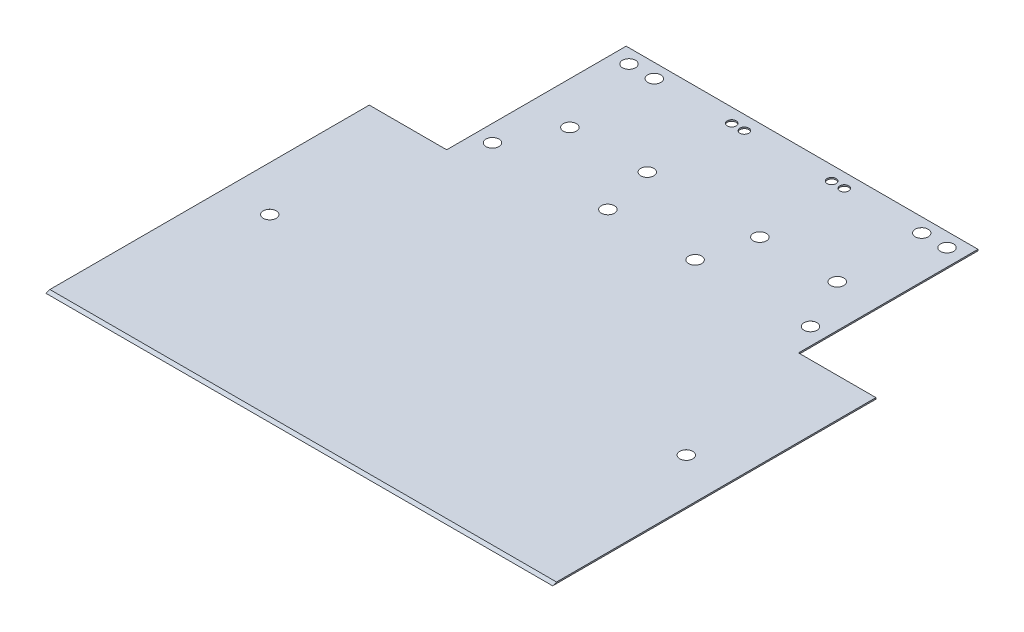
from build123d import *

# Parameters (mm, degrees)
SALIENTE_EXTRUIR1_DEPTH          = 0.5
CORTAR_EXTRUIR4_REACH            = 128.793
CROQUIS6_R                       = 1.585
CORTAR_EXTRUIR5_REACH            = 128.793
CROQUIS7_R                       = 1.585
CORTAR_EXTRUIR6_REACH            = 128.793
CROQUIS8_R                       = 1.585
CORTAR_EXTRUIR7_REACH            = 128.793
CROQUIS9_R                       = 1.585
CORTAR_EXTRUIR8_REACH            = 128.793
CROQUIS5_R                       = 1.585
CORTAR_EXTRUIR9_REACH            = 202.939
CROQUIS11_R                      = 3.03
CORTAR_EXTRUIR10_DEPTH           = 1
CORTAR_EXTRUIR10_DRAFT           = -55
CORTAR_EXTRUIR10_PROFILE_2_DEPTH = 1
CORTAR_EXTRUIR10_PROFILE_2_DRAFT = -55
CORTAR_EXTRUIR10_PROFILE_3_DEPTH = 1
CORTAR_EXTRUIR10_PROFILE_3_DRAFT = -55
CORTAR_EXTRUIR10_PROFILE_4_DEPTH = 1
CORTAR_EXTRUIR10_PROFILE_4_DRAFT = -55
CORTAR_EXTRUIR10_PROFILE_5_DEPTH = 1
CORTAR_EXTRUIR10_PROFILE_5_DRAFT = -55
CORTAR_EXTRUIR10_PROFILE_6_DEPTH = 1
CORTAR_EXTRUIR10_PROFILE_6_DRAFT = -55
CORTAR_EXTRUIR10_PROFILE_7_DEPTH = 1
CORTAR_EXTRUIR10_PROFILE_7_DRAFT = -55
SIMETR_A7_COPY_1_SKETCH_R        = 3.03
SIMETR_A7_COPY_1_DEPTH           = 1
SIMETR_A7_COPY_1_DRAFT           = -55
SIMETR_A7_COPY_2_SKETCH_R        = 3.03
SIMETR_A7_COPY_2_DEPTH           = 1
SIMETR_A7_COPY_2_DRAFT           = -55
SIMETR_A7_COPY_3_SKETCH_R        = 3.03
SIMETR_A7_COPY_3_DEPTH           = 1
SIMETR_A7_COPY_3_DRAFT           = -55
SIMETR_A7_COPY_4_SKETCH_R        = 3.03
SIMETR_A7_COPY_4_DEPTH           = 1
SIMETR_A7_COPY_4_DRAFT           = -55
SIMETR_A7_COPY_5_SKETCH_R        = 3.03
SIMETR_A7_COPY_5_DEPTH           = 1
SIMETR_A7_COPY_5_DRAFT           = -55
SIMETR_A7_COPY_6_SKETCH_R        = 3.03
SIMETR_A7_COPY_6_DEPTH           = 1
SIMETR_A7_COPY_6_DRAFT           = -55
SIMETR_A7_COPY_7_SKETCH_R        = 3.03
SIMETR_A7_COPY_7_DEPTH           = 1
SIMETR_A7_COPY_7_DRAFT           = -55
SIMETR_A7_COPY_8_SKETCH_R        = 3.03
SIMETR_A7_COPY_8_DEPTH           = 1
SIMETR_A7_COPY_8_DRAFT           = -55
SIMETR_A7_COPY_9_SKETCH_R        = 3.03
SIMETR_A7_COPY_9_DEPTH           = 1
SIMETR_A7_COPY_9_DRAFT           = -55
SIMETR_A7_COPY_10_SKETCH_R       = 3.03
SIMETR_A7_COPY_10_DEPTH          = 1
SIMETR_A7_COPY_10_DRAFT          = -55
SIMETR_A7_COPY_11_SKETCH_R       = 3.03
SIMETR_A7_COPY_11_DEPTH          = 1
SIMETR_A7_COPY_11_DRAFT          = -55
SIMETR_A7_COPY_12_SKETCH_R       = 3.03
SIMETR_A7_COPY_12_DEPTH          = 1
SIMETR_A7_COPY_12_DRAFT          = -55
SIMETR_A7_COPY_13_SKETCH_R       = 3.03
SIMETR_A7_COPY_13_DEPTH          = 1
SIMETR_A7_COPY_13_DRAFT          = -55


with BuildPart() as part:
    # Croquis2 → Saliente-Extruir1 (new body)
    with BuildSketch(Plane(origin=(0, 0, 0), x_dir=(1, 0, 0), z_dir=(0, 1, 0))):
        Polygon((-90, 25.54), (-62.5, 25.54), (-62.5, 89.31), (62.5, 89.31), (62.5, 25.54), (90, 25.54), (90, -89.31), (-90, -89.31), align=None)
    saliente_extruir1 = extrude(amount=SALIENTE_EXTRUIR1_DEPTH)

    # Croquis6 → Cortar-Extruir4 (cut, up to next)
    with BuildSketch(Plane(origin=(0, 0.5, 0), x_dir=(1, 0, 0), z_dir=(0, 1, 0)), mode=Mode.PRIVATE) as cortar_extruir4_sk1:
        with Locations((-56.5, 35.81)):
            Circle(CROQUIS6_R)
    cortar_extruir4_tool1 = extrude(cortar_extruir4_sk1.sketch, amount=-CORTAR_EXTRUIR4_REACH, mode=Mode.PRIVATE) & part.part
    # Croquis6 → Cortar-Extruir4 (cut, up to next)
    with BuildSketch(Plane(origin=(0, 0.5, 0), x_dir=(1, 0, 0), z_dir=(0, 1, 0)), mode=Mode.PRIVATE) as cortar_extruir4_sk2:
        with Locations((-15.5, 35.81)):
            Circle(CROQUIS6_R)
    cortar_extruir4_tool2 = extrude(cortar_extruir4_sk2.sketch, amount=-CORTAR_EXTRUIR4_REACH, mode=Mode.PRIVATE) & part.part
    # Croquis6 → Cortar-Extruir4 (cut, up to next)
    with BuildSketch(Plane(origin=(0, 0.5, 0), x_dir=(1, 0, 0), z_dir=(0, 1, 0)), mode=Mode.PRIVATE) as cortar_extruir4_sk3:
        with Locations((-15.5, 84.31)):
            Circle(CROQUIS6_R)
    cortar_extruir4_tool3 = extrude(cortar_extruir4_sk3.sketch, amount=-CORTAR_EXTRUIR4_REACH, mode=Mode.PRIVATE) & part.part
    # Croquis6 → Cortar-Extruir4 (cut, up to next)
    with BuildSketch(Plane(origin=(0, 0.5, 0), x_dir=(1, 0, 0), z_dir=(0, 1, 0)), mode=Mode.PRIVATE) as cortar_extruir4_sk4:
        with Locations((-56.5, 84.31)):
            Circle(CROQUIS6_R)
    cortar_extruir4_tool4 = extrude(cortar_extruir4_sk4.sketch, amount=-CORTAR_EXTRUIR4_REACH, mode=Mode.PRIVATE) & part.part
    add(cortar_extruir4_tool1.solids().sort_by_distance((-56.5, 0.5, -35.81))[0], mode=Mode.SUBTRACT)
    add(cortar_extruir4_tool2.solids().sort_by_distance((-15.5, 0.5, -35.81))[0], mode=Mode.SUBTRACT)
    add(cortar_extruir4_tool3.solids().sort_by_distance((-15.5, 0.5, -84.31))[0], mode=Mode.SUBTRACT)
    add(cortar_extruir4_tool4.solids().sort_by_distance((-56.5, 0.5, -84.31))[0], mode=Mode.SUBTRACT)

    # Croquis7 → Cortar-Extruir5 (cut, up to next)
    with BuildSketch(Plane(origin=(0, 0.5, 0), x_dir=(1, 0, 0), z_dir=(0, 1, 0)), mode=Mode.PRIVATE) as cortar_extruir5_sk1:
        with Locations((56.5, 35.81)):
            Circle(CROQUIS7_R)
    cortar_extruir5_tool1 = extrude(cortar_extruir5_sk1.sketch, amount=-CORTAR_EXTRUIR5_REACH, mode=Mode.PRIVATE) & part.part
    # Croquis7 → Cortar-Extruir5 (cut, up to next)
    with BuildSketch(Plane(origin=(0, 0.5, 0), x_dir=(1, 0, 0), z_dir=(0, 1, 0)), mode=Mode.PRIVATE) as cortar_extruir5_sk2:
        with Locations((15.5, 35.81)):
            Circle(CROQUIS7_R)
    cortar_extruir5_tool2 = extrude(cortar_extruir5_sk2.sketch, amount=-CORTAR_EXTRUIR5_REACH, mode=Mode.PRIVATE) & part.part
    # Croquis7 → Cortar-Extruir5 (cut, up to next)
    with BuildSketch(Plane(origin=(0, 0.5, 0), x_dir=(1, 0, 0), z_dir=(0, 1, 0)), mode=Mode.PRIVATE) as cortar_extruir5_sk3:
        with Locations((15.5, 84.31)):
            Circle(CROQUIS7_R)
    cortar_extruir5_tool3 = extrude(cortar_extruir5_sk3.sketch, amount=-CORTAR_EXTRUIR5_REACH, mode=Mode.PRIVATE) & part.part
    # Croquis7 → Cortar-Extruir5 (cut, up to next)
    with BuildSketch(Plane(origin=(0, 0.5, 0), x_dir=(1, 0, 0), z_dir=(0, 1, 0)), mode=Mode.PRIVATE) as cortar_extruir5_sk4:
        with Locations((56.5, 84.31)):
            Circle(CROQUIS7_R)
    cortar_extruir5_tool4 = extrude(cortar_extruir5_sk4.sketch, amount=-CORTAR_EXTRUIR5_REACH, mode=Mode.PRIVATE) & part.part
    add(cortar_extruir5_tool1.solids().sort_by_distance((56.5, 0.5, -35.81))[0], mode=Mode.SUBTRACT)
    add(cortar_extruir5_tool2.solids().sort_by_distance((15.5, 0.5, -35.81))[0], mode=Mode.SUBTRACT)
    add(cortar_extruir5_tool3.solids().sort_by_distance((15.5, 0.5, -84.31))[0], mode=Mode.SUBTRACT)
    add(cortar_extruir5_tool4.solids().sort_by_distance((56.5, 0.5, -84.31))[0], mode=Mode.SUBTRACT)

    # Simetría3: Saliente-Extruir1 across plane
    add(saliente_extruir1.mirror(Plane(origin=(0, 0, 0), x_dir=(0, 0, 1), z_dir=(1, 0, 0))))

    # Croquis8 → Cortar-Extruir6 (cut, up to next)
    with BuildSketch(Plane(origin=(0, 0.5, 0), x_dir=(1, 0, 0), z_dir=(0, 1, 0)), mode=Mode.PRIVATE) as cortar_extruir6_sk1:
        with Locations((-20, 54.31)):
            Circle(CROQUIS8_R)
    cortar_extruir6_tool1 = extrude(cortar_extruir6_sk1.sketch, amount=-CORTAR_EXTRUIR6_REACH, mode=Mode.PRIVATE) & part.part
    # Croquis8 → Cortar-Extruir6 (cut, up to next)
    with BuildSketch(Plane(origin=(0, 0.5, 0), x_dir=(1, 0, 0), z_dir=(0, 1, 0)), mode=Mode.PRIVATE) as cortar_extruir6_sk2:
        with Locations((-47.5, 54.31)):
            Circle(CROQUIS8_R)
    cortar_extruir6_tool2 = extrude(cortar_extruir6_sk2.sketch, amount=-CORTAR_EXTRUIR6_REACH, mode=Mode.PRIVATE) & part.part
    # Croquis8 → Cortar-Extruir6 (cut, up to next)
    with BuildSketch(Plane(origin=(0, 0.5, 0), x_dir=(1, 0, 0), z_dir=(0, 1, 0)), mode=Mode.PRIVATE) as cortar_extruir6_sk3:
        with Locations((-47.5, 84.31)):
            Circle(CROQUIS8_R)
    cortar_extruir6_tool3 = extrude(cortar_extruir6_sk3.sketch, amount=-CORTAR_EXTRUIR6_REACH, mode=Mode.PRIVATE) & part.part
    # Croquis8 → Cortar-Extruir6 (cut, up to next)
    with BuildSketch(Plane(origin=(0, 0.5, 0), x_dir=(1, 0, 0), z_dir=(0, 1, 0)), mode=Mode.PRIVATE) as cortar_extruir6_sk4:
        with Locations((-20, 84.31)):
            Circle(CROQUIS8_R)
    cortar_extruir6_tool4 = extrude(cortar_extruir6_sk4.sketch, amount=-CORTAR_EXTRUIR6_REACH, mode=Mode.PRIVATE) & part.part
    cortar_extruir6_1 = cortar_extruir6_tool1.solids().sort_by_distance((-20, 0.5, -54.31))[0]
    add(cortar_extruir6_1, mode=Mode.SUBTRACT)
    cortar_extruir6_2 = cortar_extruir6_tool2.solids().sort_by_distance((-47.5, 0.5, -54.31))[0]
    add(cortar_extruir6_2, mode=Mode.SUBTRACT)
    cortar_extruir6_3 = cortar_extruir6_tool3.solids().sort_by_distance((-47.5, 0.5, -84.31))[0]
    add(cortar_extruir6_3, mode=Mode.SUBTRACT)
    cortar_extruir6_4 = cortar_extruir6_tool4.solids().sort_by_distance((-20, 0.5, -84.31))[0]
    add(cortar_extruir6_4, mode=Mode.SUBTRACT)
    cortar_extruir6 = cortar_extruir6_1 + cortar_extruir6_2 + cortar_extruir6_3 + cortar_extruir6_4  # Cortar-Extruir6 as one shape, for the pattern or mirror that repeats it

    # Simetría4: Cortar-Extruir6 across plane
    add(cortar_extruir6.mirror(Plane(origin=(0, 0, 0), x_dir=(0, 0, 1), z_dir=(1, 0, 0))), mode=Mode.SUBTRACT)

    # Croquis9 → Cortar-Extruir7 (cut, up to next)
    with BuildSketch(Plane.XZ, mode=Mode.PRIVATE) as cortar_extruir7_sk1:
        with Locations((56.5, -35.81)):
            Circle(CROQUIS9_R)
    cortar_extruir7_tool1 = extrude(cortar_extruir7_sk1.sketch, amount=-CORTAR_EXTRUIR7_REACH, mode=Mode.PRIVATE) & part.part
    # Croquis9 → Cortar-Extruir7 (cut, up to next)
    with BuildSketch(Plane.XZ, mode=Mode.PRIVATE) as cortar_extruir7_sk2:
        with Locations((15.5, -35.81)):
            Circle(CROQUIS9_R)
    cortar_extruir7_tool2 = extrude(cortar_extruir7_sk2.sketch, amount=-CORTAR_EXTRUIR7_REACH, mode=Mode.PRIVATE) & part.part
    # Croquis9 → Cortar-Extruir7 (cut, up to next)
    with BuildSketch(Plane.XZ, mode=Mode.PRIVATE) as cortar_extruir7_sk3:
        with Locations((15.5, -84.31)):
            Circle(CROQUIS9_R)
    cortar_extruir7_tool3 = extrude(cortar_extruir7_sk3.sketch, amount=-CORTAR_EXTRUIR7_REACH, mode=Mode.PRIVATE) & part.part
    # Croquis9 → Cortar-Extruir7 (cut, up to next)
    with BuildSketch(Plane.XZ, mode=Mode.PRIVATE) as cortar_extruir7_sk4:
        with Locations((56.5, -84.31)):
            Circle(CROQUIS9_R)
    cortar_extruir7_tool4 = extrude(cortar_extruir7_sk4.sketch, amount=-CORTAR_EXTRUIR7_REACH, mode=Mode.PRIVATE) & part.part
    cortar_extruir7_1 = cortar_extruir7_tool1.solids().sort_by_distance((56.5, 0, -35.81))[0]
    add(cortar_extruir7_1, mode=Mode.SUBTRACT)
    cortar_extruir7_2 = cortar_extruir7_tool2.solids().sort_by_distance((15.5, 0, -35.81))[0]
    add(cortar_extruir7_2, mode=Mode.SUBTRACT)
    cortar_extruir7_3 = cortar_extruir7_tool3.solids().sort_by_distance((15.5, 0, -84.31))[0]
    add(cortar_extruir7_3, mode=Mode.SUBTRACT)
    cortar_extruir7_4 = cortar_extruir7_tool4.solids().sort_by_distance((56.5, 0, -84.31))[0]
    add(cortar_extruir7_4, mode=Mode.SUBTRACT)
    cortar_extruir7 = cortar_extruir7_1 + cortar_extruir7_2 + cortar_extruir7_3 + cortar_extruir7_4  # Cortar-Extruir7 as one shape, for the pattern or mirror that repeats it

    # Simetría5: Cortar-Extruir7 across plane
    add(cortar_extruir7.mirror(Plane(origin=(0, 0, 0), x_dir=(0, 0, 1), z_dir=(1, 0, 0))), mode=Mode.SUBTRACT)

    # Croquis5 → Cortar-Extruir8 (cut, up to next)
    with BuildSketch(Plane(origin=(0, 0.5, 0), x_dir=(1, 0, 0), z_dir=(0, 1, 0)), mode=Mode.PRIVATE) as cortar_extruir8_sk1:
        with Locations((74, -25.820403824)):
            Circle(CROQUIS5_R)
    cortar_extruir8_tool1 = extrude(cortar_extruir8_sk1.sketch, amount=-CORTAR_EXTRUIR8_REACH, mode=Mode.PRIVATE) & part.part
    cortar_extruir8 = cortar_extruir8_tool1.solids().sort_by_distance((74, 0.5, 25.820404))[0]
    add(cortar_extruir8, mode=Mode.SUBTRACT)

    # Simetría6: Cortar-Extruir8 across plane
    add(cortar_extruir8.mirror(Plane(origin=(0, 0, 0), x_dir=(0, 0, 1), z_dir=(1, 0, 0))), mode=Mode.SUBTRACT)

    # Croquis3 → Cortar-Extruir9 (cut, up to next)
    with BuildSketch(Plane(origin=(90, 0, 0), x_dir=(0, 0, -1), z_dir=(1, 0, 0)), mode=Mode.PRIVATE) as cortar_extruir9_sk1:
        Polygon((-89.31, 0), (-87.93626129, 0.5), (-89.31, 0.5), align=None)
    cortar_extruir9_tool1 = extrude(cortar_extruir9_sk1.sketch, amount=-CORTAR_EXTRUIR9_REACH, mode=Mode.PRIVATE) & part.part
    add(cortar_extruir9_tool1.solids().sort_by_distance((90, 0.333333, 88.852087))[0], mode=Mode.SUBTRACT)


with BuildPart() as cortar_extruir10_tool:
    # Croquis11 → Cortar-Extruir10 (with draft: the straight prism first)
    with BuildSketch(Plane.XZ):
        with Locations((-74, 25.820403824)):
            Circle(CROQUIS11_R)
    extrude(amount=-CORTAR_EXTRUIR10_DEPTH)
    # Cortar-Extruir10: the draft: its side faces are tilted about the plane it starts from
    cortar_extruir10_sides = [cortar_extruir10_tool.faces().sort_by_distance(p)[0] for p in [
        (-77.03, 0.5, 25.820403824),
    ]]
    draft(cortar_extruir10_sides, Plane.XZ, CORTAR_EXTRUIR10_DRAFT)


with BuildPart() as part_1:
    add(part.part)

    # Cortar-Extruir10: cut by cortar_extruir10_tool
    add(cortar_extruir10_tool.part, mode=Mode.SUBTRACT)


with BuildPart() as cortar_extruir10_profile_2_tool:
    # Croquis11 → Cortar-Extruir10 profile 2 (with draft: the straight prism first)
    with BuildSketch(Plane.XZ):
        with Locations((-56.5, -35.81)):
            Circle(CROQUIS11_R)
    extrude(amount=-CORTAR_EXTRUIR10_PROFILE_2_DEPTH)
    # Cortar-Extruir10 profile 2: the draft: its side faces are tilted about the plane it starts from
    cortar_extruir10_profile_2_sides = [cortar_extruir10_profile_2_tool.faces().sort_by_distance(p)[0] for p in [
        (-59.53, 0.5, -35.81),
    ]]
    draft(cortar_extruir10_profile_2_sides, Plane.XZ, CORTAR_EXTRUIR10_PROFILE_2_DRAFT)


with BuildPart() as part_2:
    add(part_1.part)

    # Cortar-Extruir10 profile 2: cut by cortar_extruir10_profile_2_tool
    add(cortar_extruir10_profile_2_tool.part, mode=Mode.SUBTRACT)


with BuildPart() as cortar_extruir10_profile_3_tool:
    # Croquis11 → Cortar-Extruir10 profile 3 (with draft: the straight prism first)
    with BuildSketch(Plane.XZ):
        with Locations((-15.5, -35.81)):
            Circle(CROQUIS11_R)
    extrude(amount=-CORTAR_EXTRUIR10_PROFILE_3_DEPTH)
    # Cortar-Extruir10 profile 3: the draft: its side faces are tilted about the plane it starts from
    cortar_extruir10_profile_3_sides = [cortar_extruir10_profile_3_tool.faces().sort_by_distance(p)[0] for p in [
        (-18.53, 0.5, -35.81),
    ]]
    draft(cortar_extruir10_profile_3_sides, Plane.XZ, CORTAR_EXTRUIR10_PROFILE_3_DRAFT)


with BuildPart() as part_3:
    add(part_2.part)

    # Cortar-Extruir10 profile 3: cut by cortar_extruir10_profile_3_tool
    add(cortar_extruir10_profile_3_tool.part, mode=Mode.SUBTRACT)


with BuildPart() as cortar_extruir10_profile_4_tool:
    # Croquis11 → Cortar-Extruir10 profile 4 (with draft: the straight prism first)
    with BuildSketch(Plane.XZ):
        with Locations((-20, -54.31)):
            Circle(CROQUIS11_R)
    extrude(amount=-CORTAR_EXTRUIR10_PROFILE_4_DEPTH)
    # Cortar-Extruir10 profile 4: the draft: its side faces are tilted about the plane it starts from
    cortar_extruir10_profile_4_sides = [cortar_extruir10_profile_4_tool.faces().sort_by_distance(p)[0] for p in [
        (-23.03, 0.5, -54.31),
    ]]
    draft(cortar_extruir10_profile_4_sides, Plane.XZ, CORTAR_EXTRUIR10_PROFILE_4_DRAFT)


with BuildPart() as part_4:
    add(part_3.part)

    # Cortar-Extruir10 profile 4: cut by cortar_extruir10_profile_4_tool
    add(cortar_extruir10_profile_4_tool.part, mode=Mode.SUBTRACT)


with BuildPart() as cortar_extruir10_profile_5_tool:
    # Croquis11 → Cortar-Extruir10 profile 5 (with draft: the straight prism first)
    with BuildSketch(Plane.XZ):
        with Locations((-47.5, -54.31)):
            Circle(CROQUIS11_R)
    extrude(amount=-CORTAR_EXTRUIR10_PROFILE_5_DEPTH)
    # Cortar-Extruir10 profile 5: the draft: its side faces are tilted about the plane it starts from
    cortar_extruir10_profile_5_sides = [cortar_extruir10_profile_5_tool.faces().sort_by_distance(p)[0] for p in [
        (-50.53, 0.5, -54.31),
    ]]
    draft(cortar_extruir10_profile_5_sides, Plane.XZ, CORTAR_EXTRUIR10_PROFILE_5_DRAFT)


with BuildPart() as part_5:
    add(part_4.part)

    # Cortar-Extruir10 profile 5: cut by cortar_extruir10_profile_5_tool
    add(cortar_extruir10_profile_5_tool.part, mode=Mode.SUBTRACT)


with BuildPart() as cortar_extruir10_profile_6_tool:
    # Croquis11 → Cortar-Extruir10 profile 6 (with draft: the straight prism first)
    with BuildSketch(Plane.XZ):
        with Locations((-47.5, -84.31)):
            Circle(CROQUIS11_R)
    extrude(amount=-CORTAR_EXTRUIR10_PROFILE_6_DEPTH)
    # Cortar-Extruir10 profile 6: the draft: its side faces are tilted about the plane it starts from
    cortar_extruir10_profile_6_sides = [cortar_extruir10_profile_6_tool.faces().sort_by_distance(p)[0] for p in [
        (-50.53, 0.5, -84.31),
    ]]
    draft(cortar_extruir10_profile_6_sides, Plane.XZ, CORTAR_EXTRUIR10_PROFILE_6_DRAFT)


with BuildPart() as part_6:
    add(part_5.part)

    # Cortar-Extruir10 profile 6: cut by cortar_extruir10_profile_6_tool
    add(cortar_extruir10_profile_6_tool.part, mode=Mode.SUBTRACT)


with BuildPart() as cortar_extruir10_profile_7_tool:
    # Croquis11 → Cortar-Extruir10 profile 7 (with draft: the straight prism first)
    with BuildSketch(Plane.XZ):
        with Locations((-56.5, -84.31)):
            Circle(CROQUIS11_R)
    extrude(amount=-CORTAR_EXTRUIR10_PROFILE_7_DEPTH)
    # Cortar-Extruir10 profile 7: the draft: its side faces are tilted about the plane it starts from
    cortar_extruir10_profile_7_sides = [cortar_extruir10_profile_7_tool.faces().sort_by_distance(p)[0] for p in [
        (-59.53, 0.5, -84.31),
    ]]
    draft(cortar_extruir10_profile_7_sides, Plane.XZ, CORTAR_EXTRUIR10_PROFILE_7_DRAFT)


with BuildPart() as part_7:
    add(part_6.part)

    # Cortar-Extruir10 profile 7: cut by cortar_extruir10_profile_7_tool
    add(cortar_extruir10_profile_7_tool.part, mode=Mode.SUBTRACT)


with BuildPart() as simetr_a7_copy_1_tool:
    # Simetría7 copy 1 sketch → Simetría7 copy 1 (with draft: the straight prism first)
    with BuildSketch(Plane(origin=(0, 0, 0), x_dir=(-1, 0, 0), z_dir=(0, -1, 0))):
        with Locations((-74, -25.820403824)):
            Circle(SIMETR_A7_COPY_1_SKETCH_R)
    extrude(amount=-SIMETR_A7_COPY_1_DEPTH)
    # Simetría7 copy 1: the draft: its side faces are tilted about the plane it starts from
    simetr_a7_copy_1_sides = [simetr_a7_copy_1_tool.faces().sort_by_distance(p)[0] for p in [
        (77.03, 0.5, 25.820403824),
    ]]
    draft(simetr_a7_copy_1_sides, Plane(origin=(0, 0, 0), x_dir=(-1, 0, 0), z_dir=(0, -1, 0)), SIMETR_A7_COPY_1_DRAFT)


with BuildPart() as part_8:
    add(part_7.part)

    # Simetría7 copy 1: cut by simetr_a7_copy_1_tool
    add(simetr_a7_copy_1_tool.part, mode=Mode.SUBTRACT)


with BuildPart() as simetr_a7_copy_2_tool:
    # Simetría7 copy 2 sketch → Simetría7 copy 2 (with draft: the straight prism first)
    with BuildSketch(Plane(origin=(0, 0, 0), x_dir=(-1, 0, 0), z_dir=(0, -1, 0))):
        with Locations((-56.5, 35.81)):
            Circle(SIMETR_A7_COPY_2_SKETCH_R)
    extrude(amount=-SIMETR_A7_COPY_2_DEPTH)
    # Simetría7 copy 2: the draft: its side faces are tilted about the plane it starts from
    simetr_a7_copy_2_sides = [simetr_a7_copy_2_tool.faces().sort_by_distance(p)[0] for p in [
        (59.53, 0.5, -35.81),
    ]]
    draft(simetr_a7_copy_2_sides, Plane(origin=(0, 0, 0), x_dir=(-1, 0, 0), z_dir=(0, -1, 0)), SIMETR_A7_COPY_2_DRAFT)


with BuildPart() as part_9:
    add(part_8.part)

    # Simetría7 copy 2: cut by simetr_a7_copy_2_tool
    add(simetr_a7_copy_2_tool.part, mode=Mode.SUBTRACT)


with BuildPart() as simetr_a7_copy_3_tool:
    # Simetría7 copy 3 sketch → Simetría7 copy 3 (with draft: the straight prism first)
    with BuildSketch(Plane(origin=(0, 0, 0), x_dir=(-1, 0, 0), z_dir=(0, -1, 0))):
        with Locations((-15.5, 35.81)):
            Circle(SIMETR_A7_COPY_3_SKETCH_R)
    extrude(amount=-SIMETR_A7_COPY_3_DEPTH)
    # Simetría7 copy 3: the draft: its side faces are tilted about the plane it starts from
    simetr_a7_copy_3_sides = [simetr_a7_copy_3_tool.faces().sort_by_distance(p)[0] for p in [
        (18.53, 0.5, -35.81),
    ]]
    draft(simetr_a7_copy_3_sides, Plane(origin=(0, 0, 0), x_dir=(-1, 0, 0), z_dir=(0, -1, 0)), SIMETR_A7_COPY_3_DRAFT)


with BuildPart() as part_10:
    add(part_9.part)

    # Simetría7 copy 3: cut by simetr_a7_copy_3_tool
    add(simetr_a7_copy_3_tool.part, mode=Mode.SUBTRACT)


with BuildPart() as simetr_a7_copy_4_tool:
    # Simetría7 copy 4 sketch → Simetría7 copy 4 (with draft: the straight prism first)
    with BuildSketch(Plane(origin=(0, 0, 0), x_dir=(-1, 0, 0), z_dir=(0, -1, 0))):
        with Locations((-20, 54.31)):
            Circle(SIMETR_A7_COPY_4_SKETCH_R)
    extrude(amount=-SIMETR_A7_COPY_4_DEPTH)
    # Simetría7 copy 4: the draft: its side faces are tilted about the plane it starts from
    simetr_a7_copy_4_sides = [simetr_a7_copy_4_tool.faces().sort_by_distance(p)[0] for p in [
        (23.03, 0.5, -54.31),
    ]]
    draft(simetr_a7_copy_4_sides, Plane(origin=(0, 0, 0), x_dir=(-1, 0, 0), z_dir=(0, -1, 0)), SIMETR_A7_COPY_4_DRAFT)


with BuildPart() as part_11:
    add(part_10.part)

    # Simetría7 copy 4: cut by simetr_a7_copy_4_tool
    add(simetr_a7_copy_4_tool.part, mode=Mode.SUBTRACT)


with BuildPart() as simetr_a7_copy_5_tool:
    # Simetría7 copy 5 sketch → Simetría7 copy 5 (with draft: the straight prism first)
    with BuildSketch(Plane(origin=(0, 0, 0), x_dir=(-1, 0, 0), z_dir=(0, -1, 0))):
        with Locations((-47.5, 54.31)):
            Circle(SIMETR_A7_COPY_5_SKETCH_R)
    extrude(amount=-SIMETR_A7_COPY_5_DEPTH)
    # Simetría7 copy 5: the draft: its side faces are tilted about the plane it starts from
    simetr_a7_copy_5_sides = [simetr_a7_copy_5_tool.faces().sort_by_distance(p)[0] for p in [
        (50.53, 0.5, -54.31),
    ]]
    draft(simetr_a7_copy_5_sides, Plane(origin=(0, 0, 0), x_dir=(-1, 0, 0), z_dir=(0, -1, 0)), SIMETR_A7_COPY_5_DRAFT)


with BuildPart() as part_12:
    add(part_11.part)

    # Simetría7 copy 5: cut by simetr_a7_copy_5_tool
    add(simetr_a7_copy_5_tool.part, mode=Mode.SUBTRACT)


with BuildPart() as simetr_a7_copy_6_tool:
    # Simetría7 copy 6 sketch → Simetría7 copy 6 (with draft: the straight prism first)
    with BuildSketch(Plane(origin=(0, 0, 0), x_dir=(-1, 0, 0), z_dir=(0, -1, 0))):
        with Locations((-47.5, 84.31)):
            Circle(SIMETR_A7_COPY_6_SKETCH_R)
    extrude(amount=-SIMETR_A7_COPY_6_DEPTH)
    # Simetría7 copy 6: the draft: its side faces are tilted about the plane it starts from
    simetr_a7_copy_6_sides = [simetr_a7_copy_6_tool.faces().sort_by_distance(p)[0] for p in [
        (50.53, 0.5, -84.31),
    ]]
    draft(simetr_a7_copy_6_sides, Plane(origin=(0, 0, 0), x_dir=(-1, 0, 0), z_dir=(0, -1, 0)), SIMETR_A7_COPY_6_DRAFT)


with BuildPart() as part_13:
    add(part_12.part)

    # Simetría7 copy 6: cut by simetr_a7_copy_6_tool
    add(simetr_a7_copy_6_tool.part, mode=Mode.SUBTRACT)


with BuildPart() as simetr_a7_copy_7_tool:
    # Simetría7 copy 7 sketch → Simetría7 copy 7 (with draft: the straight prism first)
    with BuildSketch(Plane(origin=(0, 0, 0), x_dir=(-1, 0, 0), z_dir=(0, -1, 0))):
        with Locations((-56.5, 84.31)):
            Circle(SIMETR_A7_COPY_7_SKETCH_R)
    extrude(amount=-SIMETR_A7_COPY_7_DEPTH)
    # Simetría7 copy 7: the draft: its side faces are tilted about the plane it starts from
    simetr_a7_copy_7_sides = [simetr_a7_copy_7_tool.faces().sort_by_distance(p)[0] for p in [
        (59.53, 0.5, -84.31),
    ]]
    draft(simetr_a7_copy_7_sides, Plane(origin=(0, 0, 0), x_dir=(-1, 0, 0), z_dir=(0, -1, 0)), SIMETR_A7_COPY_7_DRAFT)


with BuildPart() as part_14:
    add(part_13.part)

    # Simetría7 copy 7: cut by simetr_a7_copy_7_tool
    add(simetr_a7_copy_7_tool.part, mode=Mode.SUBTRACT)


with BuildPart() as simetr_a7_copy_8_tool:
    # Simetría7 copy 8 sketch → Simetría7 copy 8 (with draft: the straight prism first)
    with BuildSketch(Plane(origin=(0, 0, 0), x_dir=(-1, 0, 0), z_dir=(0, -1, 0))):
        with Locations((-56.5, 35.81)):
            Circle(SIMETR_A7_COPY_8_SKETCH_R)
    extrude(amount=-SIMETR_A7_COPY_8_DEPTH)
    # Simetría7 copy 8: the draft: its side faces are tilted about the plane it starts from
    simetr_a7_copy_8_sides = [simetr_a7_copy_8_tool.faces().sort_by_distance(p)[0] for p in [
        (59.53, 0.5, -35.81),
    ]]
    draft(simetr_a7_copy_8_sides, Plane(origin=(0, 0, 0), x_dir=(-1, 0, 0), z_dir=(0, -1, 0)), SIMETR_A7_COPY_8_DRAFT)


with BuildPart() as part_15:
    add(part_14.part)

    # Simetría7 copy 8: cut by simetr_a7_copy_8_tool
    add(simetr_a7_copy_8_tool.part, mode=Mode.SUBTRACT)


with BuildPart() as simetr_a7_copy_9_tool:
    # Simetría7 copy 9 sketch → Simetría7 copy 9 (with draft: the straight prism first)
    with BuildSketch(Plane(origin=(0, 0, 0), x_dir=(-1, 0, 0), z_dir=(0, -1, 0))):
        with Locations((-15.5, 35.81)):
            Circle(SIMETR_A7_COPY_9_SKETCH_R)
    extrude(amount=-SIMETR_A7_COPY_9_DEPTH)
    # Simetría7 copy 9: the draft: its side faces are tilted about the plane it starts from
    simetr_a7_copy_9_sides = [simetr_a7_copy_9_tool.faces().sort_by_distance(p)[0] for p in [
        (18.53, 0.5, -35.81),
    ]]
    draft(simetr_a7_copy_9_sides, Plane(origin=(0, 0, 0), x_dir=(-1, 0, 0), z_dir=(0, -1, 0)), SIMETR_A7_COPY_9_DRAFT)


with BuildPart() as part_16:
    add(part_15.part)

    # Simetría7 copy 9: cut by simetr_a7_copy_9_tool
    add(simetr_a7_copy_9_tool.part, mode=Mode.SUBTRACT)


with BuildPart() as simetr_a7_copy_10_tool:
    # Simetría7 copy 10 sketch → Simetría7 copy 10 (with draft: the straight prism first)
    with BuildSketch(Plane(origin=(0, 0, 0), x_dir=(-1, 0, 0), z_dir=(0, -1, 0))):
        with Locations((-20, 54.31)):
            Circle(SIMETR_A7_COPY_10_SKETCH_R)
    extrude(amount=-SIMETR_A7_COPY_10_DEPTH)
    # Simetría7 copy 10: the draft: its side faces are tilted about the plane it starts from
    simetr_a7_copy_10_sides = [simetr_a7_copy_10_tool.faces().sort_by_distance(p)[0] for p in [
        (23.03, 0.5, -54.31),
    ]]
    draft(simetr_a7_copy_10_sides, Plane(origin=(0, 0, 0), x_dir=(-1, 0, 0), z_dir=(0, -1, 0)), SIMETR_A7_COPY_10_DRAFT)


with BuildPart() as part_17:
    add(part_16.part)

    # Simetría7 copy 10: cut by simetr_a7_copy_10_tool
    add(simetr_a7_copy_10_tool.part, mode=Mode.SUBTRACT)


with BuildPart() as simetr_a7_copy_11_tool:
    # Simetría7 copy 11 sketch → Simetría7 copy 11 (with draft: the straight prism first)
    with BuildSketch(Plane(origin=(0, 0, 0), x_dir=(-1, 0, 0), z_dir=(0, -1, 0))):
        with Locations((-47.5, 54.31)):
            Circle(SIMETR_A7_COPY_11_SKETCH_R)
    extrude(amount=-SIMETR_A7_COPY_11_DEPTH)
    # Simetría7 copy 11: the draft: its side faces are tilted about the plane it starts from
    simetr_a7_copy_11_sides = [simetr_a7_copy_11_tool.faces().sort_by_distance(p)[0] for p in [
        (50.53, 0.5, -54.31),
    ]]
    draft(simetr_a7_copy_11_sides, Plane(origin=(0, 0, 0), x_dir=(-1, 0, 0), z_dir=(0, -1, 0)), SIMETR_A7_COPY_11_DRAFT)


with BuildPart() as part_18:
    add(part_17.part)

    # Simetría7 copy 11: cut by simetr_a7_copy_11_tool
    add(simetr_a7_copy_11_tool.part, mode=Mode.SUBTRACT)


with BuildPart() as simetr_a7_copy_12_tool:
    # Simetría7 copy 12 sketch → Simetría7 copy 12 (with draft: the straight prism first)
    with BuildSketch(Plane(origin=(0, 0, 0), x_dir=(-1, 0, 0), z_dir=(0, -1, 0))):
        with Locations((-47.5, 84.31)):
            Circle(SIMETR_A7_COPY_12_SKETCH_R)
    extrude(amount=-SIMETR_A7_COPY_12_DEPTH)
    # Simetría7 copy 12: the draft: its side faces are tilted about the plane it starts from
    simetr_a7_copy_12_sides = [simetr_a7_copy_12_tool.faces().sort_by_distance(p)[0] for p in [
        (50.53, 0.5, -84.31),
    ]]
    draft(simetr_a7_copy_12_sides, Plane(origin=(0, 0, 0), x_dir=(-1, 0, 0), z_dir=(0, -1, 0)), SIMETR_A7_COPY_12_DRAFT)


with BuildPart() as part_19:
    add(part_18.part)

    # Simetría7 copy 12: cut by simetr_a7_copy_12_tool
    add(simetr_a7_copy_12_tool.part, mode=Mode.SUBTRACT)


with BuildPart() as simetr_a7_copy_13_tool:
    # Simetría7 copy 13 sketch → Simetría7 copy 13 (with draft: the straight prism first)
    with BuildSketch(Plane(origin=(0, 0, 0), x_dir=(-1, 0, 0), z_dir=(0, -1, 0))):
        with Locations((-56.5, 84.31)):
            Circle(SIMETR_A7_COPY_13_SKETCH_R)
    extrude(amount=-SIMETR_A7_COPY_13_DEPTH)
    # Simetría7 copy 13: the draft: its side faces are tilted about the plane it starts from
    simetr_a7_copy_13_sides = [simetr_a7_copy_13_tool.faces().sort_by_distance(p)[0] for p in [
        (59.53, 0.5, -84.31),
    ]]
    draft(simetr_a7_copy_13_sides, Plane(origin=(0, 0, 0), x_dir=(-1, 0, 0), z_dir=(0, -1, 0)), SIMETR_A7_COPY_13_DRAFT)


with BuildPart() as part_20:
    add(part_19.part)

    # Simetría7 copy 13: cut by simetr_a7_copy_13_tool
    add(simetr_a7_copy_13_tool.part, mode=Mode.SUBTRACT)


solid = part_20.part
